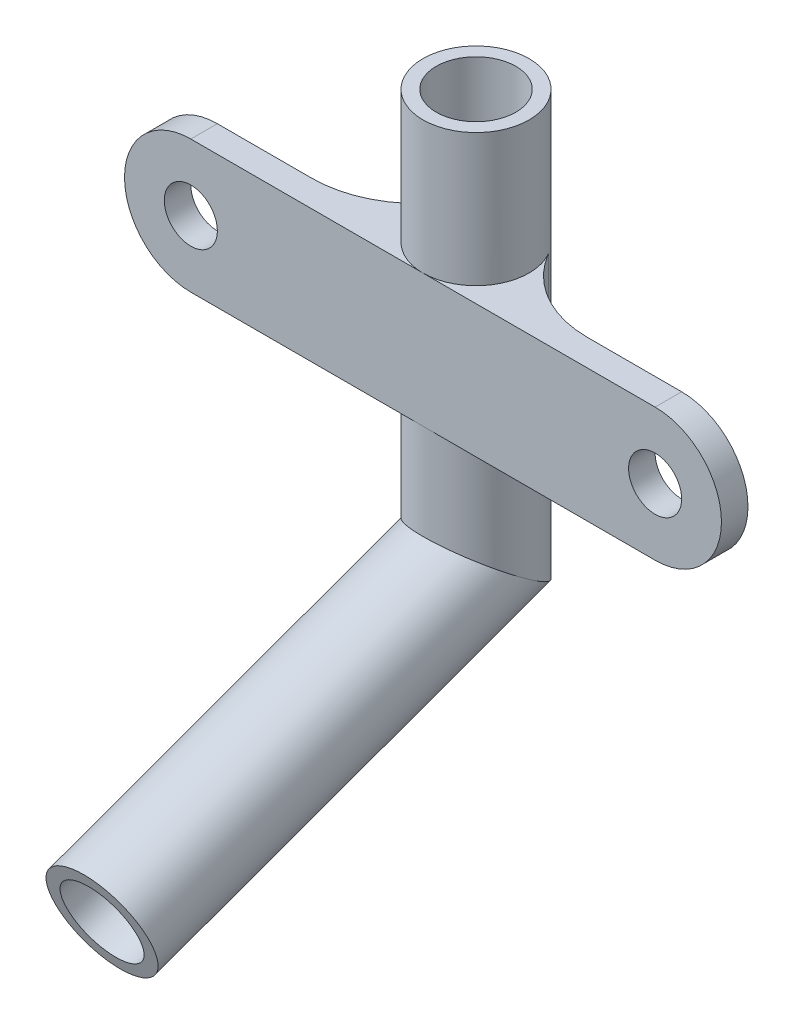
from build123d import *

# Parameters (mm, degrees)
SKETCH1_R           = 4
SKETCH1_R_2         = 3
SKETCH3_R           = 2
BOSS_EXTRUDE1_DEPTH = 2
FILLET1_R           = 8


with BuildPart() as part:
    # Sweep1: sweep along a path in Sketch2
    with BuildLine(Plane(origin=(0, 0, 0), x_dir=(0, 0, -1), z_dir=(1, 0, 0))) as sweep1_path:
        Line((0, 0), (0, -30))
        Line((0, -30), (-28.190778624, -40.2606043))
    # Sketch1 → Sweep1 (sweep)
    with BuildSketch(Plane(origin=(0, 0, 0), x_dir=(1, 0, 0), z_dir=(0, 1, 0))):
        Circle(SKETCH1_R)
        Circle(SKETCH1_R_2, mode=Mode.SUBTRACT)
    sweep(path=sweep1_path.line, transition=Transition.RIGHT)

    # Sketch3 → Boss-Extrude1 (add)
    with BuildSketch(Plane.XY.offset(4)):
        with BuildLine():
            Line((17.5, -20), (-17.5, -20))
            ThreePointArc((-17.5, -20), (-22.5, -15), (-17.5, -10))
            Line((-17.5, -10), (17.5, -10))
            ThreePointArc((17.5, -10), (22.5, -15), (17.5, -20))
        make_face()
        with Locations((17.5, -15)):
            Circle(SKETCH3_R, mode=Mode.SUBTRACT)
        with Locations((-17.5, -15)):
            Circle(SKETCH3_R, mode=Mode.SUBTRACT)
    extrude(amount=-BOSS_EXTRUDE1_DEPTH)

    # Fillet1
    # the kernel refuses this fillet: 8 mm, written as the material it adds along each edge
    with BuildSketch(Plane(origin=(-3.464101615, -10, 2), x_dir=(0, 0, -1), z_dir=(0, -1, 0))) as fillet1_piece_1:
        with BuildLine():
            CenterArc((8, -6.92820323), FILLET1_R, 120, 60)
            Line((0, -6.92820323), (0, 0))
            ThreePointArc((0, 0), (2, -0.535898385), (4, 0))
        make_face()
    extrude(amount=10)
    with BuildSketch(Plane(origin=(3.464101615, -10, 2), x_dir=(0, 0, -1), z_dir=(0, -1, 0))) as fillet1_piece_2:
        with BuildLine():
            CenterArc((8, 6.92820323), FILLET1_R, 180, 60)
            Line((0, 6.92820323), (0, 0))
            ThreePointArc((0, 0), (2, 0.535898385), (4, 0))
        make_face()
    extrude(amount=10)


solid = part.part
